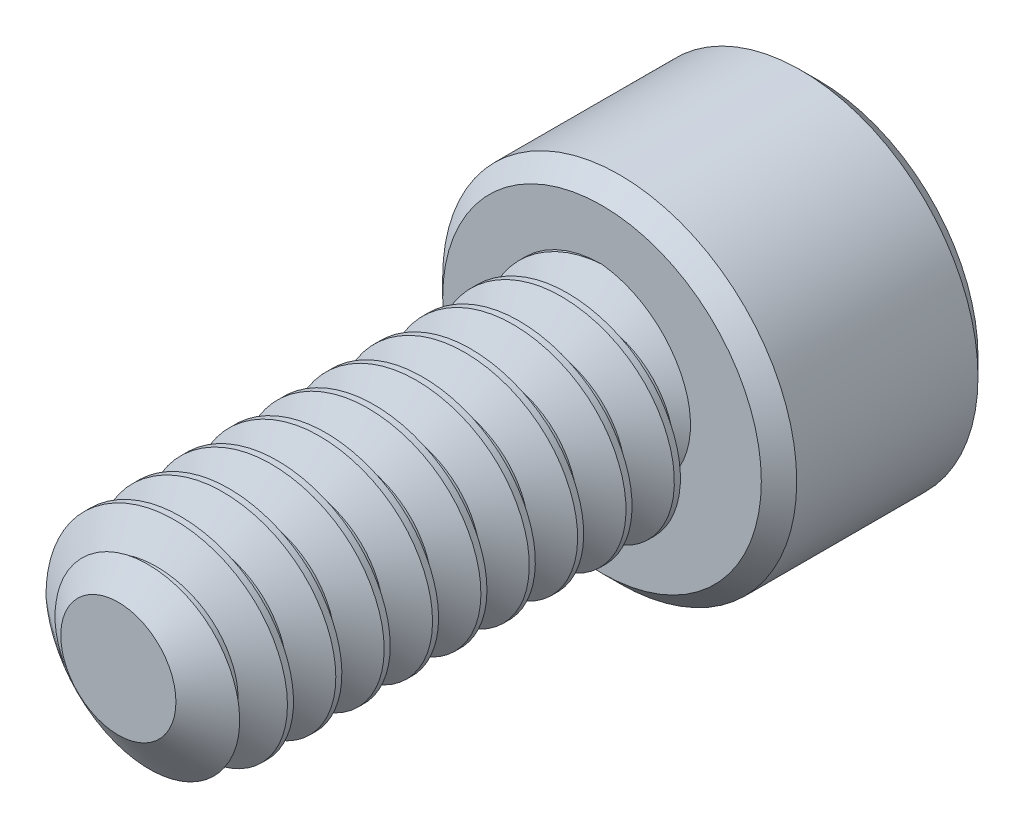
from build123d import *

# Parameters (mm, degrees)
SKETCH1_R          = 1.4224
EXTRUDE1_DEPTH     = 6.35
CUT_SWEEP1_PITCH   = 0.635
SKETCH6_R          = 2.3241
EXTRUDE2_DEPTH     = 2.8448
CUT_EXTRUDE1_DEPTH = 1.7859375
CHAMFER1_SIZE      = 0.23241


with BuildPart() as part:
    # Sketch1 → Extrude1 (new body)
    with BuildSketch(Plane.XY):
        Circle(SKETCH1_R)
    extrude(amount=-EXTRUDE1_DEPTH)

    # Cut-Sweep1: the profile of Sketch3 profile screwed along a right-hand helix of 11 turns, 6 arcs to a turn; built about Z, then put on its axis
    cut_sweep1_z = Axis((0, 0, 0), (0, 0, 1))
    cut_sweep1_corners = [(1.4227, 0, -0.555798205), (1.009955401, 0, -0.3175), (1.009955401, 0, -0.238125), (1.4227, 0, 0.000173205)]
    with BuildLine(mode=Mode.PRIVATE) as cut_sweep1_profile:
        Line(cut_sweep1_corners[0], cut_sweep1_corners[1])
        Line(cut_sweep1_corners[1], cut_sweep1_corners[2])
        Line(cut_sweep1_corners[2], cut_sweep1_corners[3])
        Line(cut_sweep1_corners[3], cut_sweep1_corners[0])
    cut_sweep1_cap = Face(cut_sweep1_profile.wire())
    cut_sweep1_turn_angles = [0, 30, 60, 90, 120, 150, 180, 210, 240, 270, 300, 330, 360]
    cut_sweep1_turn_weights = [1, 0.8660254037844387, 1, 0.8660254037844387, 1, 0.8660254037844387, 1, 0.8660254037844387, 1, 0.8660254037844387, 1, 0.8660254037844387, 1]
    cut_sweep1_turn_rails = [Edge.make_bspline([Vector(p[0], p[1], 0).rotate(cut_sweep1_z, cut_sweep1_turn_angles[k]) / cut_sweep1_turn_weights[k] + Vector(0, 0, p[2] + CUT_SWEEP1_PITCH * cut_sweep1_turn_angles[k] / 360) for k in range(13)], [0, 0, 0, 1, 1, 2, 2, 3, 3, 4, 4, 5, 5, 6, 6, 6], 2, cut_sweep1_turn_weights) for p in cut_sweep1_corners]
    cut_sweep1_turn_sides = [Face.make_surface_from_curves(cut_sweep1_turn_rails[p[0]], cut_sweep1_turn_rails[p[1]]) for p in [(0, 1), (1, 2), (2, 3), (3, 0)]]
    cut_sweep1 = Plane(origin=(0, 0, 0), x_dir=(0, 1, 0), z_dir=(0, 0, -1)) * Solid(Shell([*[p.moved(Location((0, 0, CUT_SWEEP1_PITCH * i))) for i in range(11) for p in cut_sweep1_turn_sides], cut_sweep1_cap, cut_sweep1_cap.rotate(cut_sweep1_z, 3960).moved(Location((0, 0, CUT_SWEEP1_PITCH * 3960 / 360)))]))
    add(cut_sweep1, mode=Mode.SUBTRACT)

    # Sketch4 → Cut-Revolve1 (revolve, cut)
    with BuildSketch(Plane(origin=(0, 0, 0), x_dir=(0, 0, -1), z_dir=(1, 0, 0)), mode=Mode.PRIVATE) as cut_revolve1_sk:
        Polygon((0.466649532, 1.4224), (0, 0.755955401), (0, 1.4224), align=None)
    revolve(cut_revolve1_sk.sketch.rotate(Axis((0, 0, 0), (0, 0, -1)), 264.795368264), axis=Axis((0, 0, 0), (0, 0, -1)), mode=Mode.SUBTRACT)

    # Sketch6 → Extrude2 (add)
    with BuildSketch(Plane(origin=(0, 0, -6.35), x_dir=(-1, 0, 0), z_dir=(0, 0, -1))):
        Circle(SKETCH6_R)
    extrude(amount=EXTRUDE2_DEPTH)

    # Sketch7 → Cut-Extrude1 (cut)
    with BuildSketch(Plane(origin=(0, 0, -9.1948), x_dir=(-1, 0, 0), z_dir=(0, 0, -1))):
        Polygon((0, 1.374815329), (-1.190625, 0.687407664), (-1.190625, -0.687407664), (0, -1.374815329), (1.190625, -0.687407664), (1.190625, 0.687407664), align=None)
    extrude(amount=-CUT_EXTRUDE1_DEPTH, mode=Mode.SUBTRACT)

    # Cut-Extrude2 cone 1 section (through the dimple's axis) → Cut-Extrude2 (revolve, cut)
    with BuildSketch(Plane(origin=(0, 0, -9.1948), x_dir=(0, 1, 0), z_dir=(1, 0, 0))):
        Polygon((0, 0), (1.374815329, 0), (0, 1.374815329), align=None)
    revolve(axis=Axis((0, 0, -9.1948), (0, 0, 1)), mode=Mode.SUBTRACT)

    # Chamfer1
    chamfer1_edges = [part.edges().sort_by_distance(p)[0] for p in [
        (2.3241, 0, -6.35),
        (2.3241, 0, -9.1948),
    ]]
    chamfer(chamfer1_edges, length=CHAMFER1_SIZE)


solid = part.part
